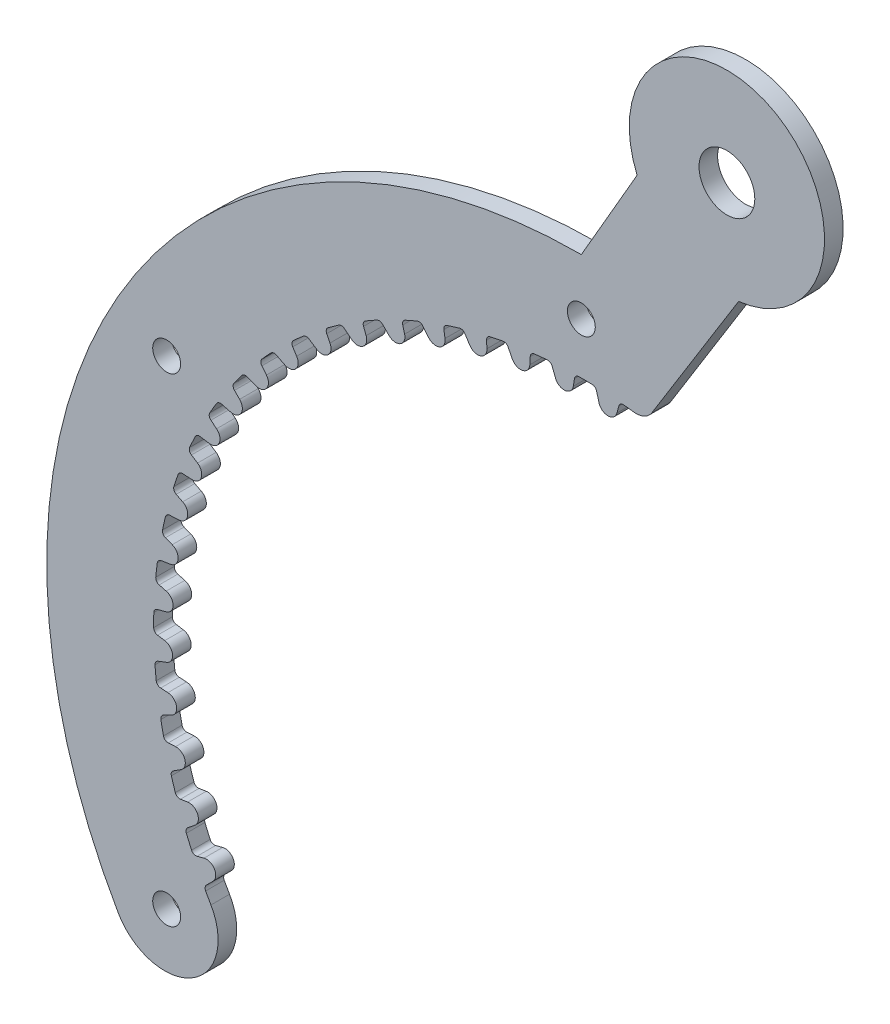
from build123d import *

# Parameters (mm, degrees)
SKETCH_1_R          = 3
EXTRUDE_1_DEPTH     = 2
FILLET_1_R          = 2
SKETCH_2_R          = 1.5
CUT_EXTRUDE_1_DEPTH = 10


with BuildPart() as part:
    # 草图1 → 凸台-拉伸1 (new body)
    with BuildSketch(Plane.XY):
        with BuildLine():
            Line((0, 57.5), (6, 67.892304845))
            ThreePointArc((6, 67.892304845), (20.905960044, 81.110184977), (16.911920088, 61.592304845))
            Line((16.911920088, 61.592304845), (6.915077614, 45.477265766))
            ThreePointArc((6.915077614, 45.477265766), (5.741141936, 45.640325254), (4.563394983, 45.773086265))
            ThreePointArc((4.563394983, 45.773086265), (4.229488065, 45.686856477), (4.030829951, 45.404962241))
            Line((4.030829951, 45.404962241), (3.828548462, 44.650037449))
            ThreePointArc((3.828548462, 44.650037449), (2.862622636, 43.908856495), (1.89669681, 44.650037449))
            Line((1.89669681, 44.650037449), (1.638205167, 45.614741393))
            ThreePointArc((1.638205167, 45.614741393), (1.46463464, 45.878112154), (1.167937224, 45.985170682))
            ThreePointArc((1.167937224, 45.985170682), (0.460926002, 45.997690673), (-0.246194138, 45.999341174))
            ThreePointArc((-0.246194138, 45.999341174), (-0.569258412, 45.878680985), (-0.737362285, 45.577565568))
            Line((-0.737362285, 45.577565568), (-0.859624526, 44.80563216))
            ThreePointArc((-0.859624526, 44.80563216), (-1.742784404, 43.967544729), (-2.780893293, 44.603698675))
            Line((-2.780893293, 44.603698675), (-3.138807912, 45.536098135))
            ThreePointArc((-3.138807912, 45.536098135), (-3.338957342, 45.779883063), (-3.645220083, 45.855341789))
            ThreePointArc((-3.645220083, 45.855341789), (-4.349666918, 45.793890397), (-5.053085905, 45.721617675))
            ThreePointArc((-5.053085905, 45.721617675), (-5.361767975, 45.567849063), (-5.497475826, 45.250811548))
            Line((-5.497475826, 45.250811548), (-5.538379289, 44.470326988))
            ThreePointArc((-5.538379289, 44.470326988), (-6.329097132, 43.544515343), (-7.428015347, 44.068672444))
            Line((-7.428015347, 44.068672444), (-7.881431555, 44.958551858))
            ThreePointArc((-7.881431555, 44.958551858), (-8.10596701, 45.180079994), (-8.418439596, 45.223112175))
            ThreePointArc((-8.418439596, 45.223112175), (-9.112603978, 45.088362675), (-9.804615006, 44.942958565))
            ThreePointArc((-9.804615006, 44.942958565), (-10.095532886, 44.757766251), (-10.197357871, 44.428280168))
            Line((-10.197357871, 44.428280168), (-10.156454408, 43.647795608))
            ThreePointArc((-10.156454408, 43.647795608), (-10.846066949, 42.644403135), (-11.993754511, 43.050820616))
            Line((-11.993754511, 43.050820616), (-12.537704585, 43.888430278))
            ThreePointArc((-12.537704585, 43.888430278), (-12.784166007, 44.085274514), (-13.099424923, 44.09540868))
            ThreePointArc((-13.099424923, 44.09540868), (-13.775701442, 43.888837417), (-14.448722692, 43.671894996))
            ThreePointArc((-14.448722692, 43.671894996), (-14.718689026, 43.457307986), (-14.785515529, 43.118983253))
            Line((-14.785515529, 43.118983253), (-14.663253288, 42.347049845))
            ThreePointArc((-14.663253288, 42.347049845), (-15.244204986, 41.277069922), (-16.42808759, 41.561294989))
            Line((-16.42808759, 41.561294989), (-17.0566119, 42.337457871))
            ThreePointArc((-17.0566119, 42.337457871), (-17.322299005, 42.50746154), (-17.636890209, 42.484586661))
            ThreePointArc((-17.636890209, 42.484586661), (-18.287869438, 42.208456871), (-18.93452715, 41.922353007))
            ThreePointArc((-18.93452715, 41.922353007), (-19.180584129, 41.68072236), (-19.211679985, 41.337265734))
            Line((-19.211679985, 41.337265734), (-19.009398497, 40.582340942))
            ThreePointArc((-19.009398497, 40.582340942), (-19.475324323, 39.457496493), (-20.682431104, 39.616415116))
            Line((-20.682431104, 39.616415116), (-21.388643405, 40.322627417))
            ThreePointArc((-21.388643405, 40.322627417), (-21.670645271, 40.463927923), (-21.981122035, 40.40829462))
            ThreePointArc((-21.981122035, 40.40829462), (-22.599671709, 40.065631639), (-23.212880965, 39.713500945))
            ThreePointArc((-23.212880965, 39.713500945), (-23.432332739, 39.447474019), (-23.427357255, 39.102648482))
            Line((-23.427357255, 39.102648482), (-23.147272757, 38.37300342))
            ThreePointArc((-23.147272757, 38.37300342), (-23.493067932, 37.205618476), (-24.710173575, 37.237489509))
            Line((-24.710173575, 37.237489509), (-25.486336457, 37.866013818))
            ThreePointArc((-25.486336457, 37.866013818), (-25.781563412, 37.977063044), (-26.084524089, 37.889280847))
            ThreePointArc((-26.084524089, 37.889280847), (-26.663867248, 37.483838963), (-27.236909599, 37.069539456))
            ThreePointArc((-27.236909599, 37.069539456), (-27.427351807, 36.782030896), (-27.386359496, 36.43961443))
            Line((-27.386359496, 36.43961443), (-27.031540654, 35.743243242))
            ThreePointArc((-27.031540654, 35.743243242), (-27.253416571, 34.546107917), (-28.467186213, 34.450582174))
            Line((-28.467186213, 34.450582174), (-29.304795874, 34.994532248))
            ThreePointArc((-29.304795874, 34.994532248), (-29.61001335, 35.074113515), (-29.902138638, 34.955144184))
            ThreePointArc((-29.902138638, 34.955144184), (-30.435927877, 34.491365503), (-30.962524952, 34.019436336))
            ThreePointArc((-30.962524952, 34.019436336), (-31.12187107, 33.713596147), (-31.045311052, 33.377340336))
            Line((-31.045311052, 33.377340336), (-30.619645334, 32.721872611))
            ThreePointArc((-30.619645334, 32.721872611), (-30.715171076, 31.50810297), (-31.912306402, 31.286227052))
            Line((-31.912306402, 31.286227052), (-32.802185815, 31.73964326))
            ThreePointArc((-32.802185815, 31.73964326), (-33.114049785, 31.786884658), (-33.392139098, 31.638031646))
            ThreePointArc((-33.392139098, 31.638031646), (-33.874526112, 31.120997424), (-34.348908402, 30.596609152))
            ThreePointArc((-34.348908402, 30.596609152), (-34.4754126, 30.275788183), (-34.364123683, 29.949377118))
            Line((-34.364123683, 29.949377118), (-33.872274772, 29.341994297))
            ThreePointArc((-33.872274772, 29.341994297), (-33.840403739, 28.124888653), (-35.007788683, 27.779093479))
            Line((-35.007788683, 27.779093479), (-35.940188143, 28.137008098))
            ThreePointArc((-35.940188143, 28.137008098), (-36.255281761, 28.151392042), (-36.516288295, 27.974286213))
            ThreePointArc((-36.516288295, 27.974286213), (-36.94198795, 27.409661186), (-37.358958024, 26.838559115))
            ThreePointArc((-37.358958024, 26.838559115), (-37.451234295, 26.506272348), (-37.306435784, 26.193282256))
            Line((-37.306435784, 26.193282256), (-36.75379248, 25.640638953))
            ThreePointArc((-36.75379248, 25.640638953), (-36.594873857, 24.433532171), (-37.719718306, 23.967606345))
            Line((-37.719718306, 23.967606345), (-38.68442225, 24.226097988))
            ThreePointArc((-38.68442225, 24.226097988), (-38.999293283, 24.207466883), (-39.240357396, 24.004048647))
            ThreePointArc((-39.240357396, 24.004048647), (-39.604705637, 23.398018964), (-39.959695083, 22.786460209))
            ThreePointArc((-39.959695083, 22.786460209), (-40.016732431, 22.446348246), (-39.840010767, 22.150208313))
            Line((-39.840010767, 22.150208313), (-39.232627946, 21.658359402))
            ThreePointArc((-39.232627946, 21.658359402), (-38.948402879, 20.474476798), (-40.018382802, 19.8935251))
            Line((-40.018382802, 19.8935251), (-41.00482173, 20.049761678))
            ThreePointArc((-41.00482173, 20.049761678), (-41.316020386, 19.998319651), (-41.53450093, 19.7708177))
            ThreePointArc((-41.53450093, 19.7708177), (-41.833505881, 19.130023149), (-42.122625362, 18.484708076))
            ThreePointArc((-42.122625362, 18.484708076), (-42.143798872, 18.140497256), (-41.937090256, 17.864452052))
            Line((-41.937090256, 17.864452052), (-41.28162253, 17.438786334))
            ThreePointArc((-41.28162253, 17.438786334), (-40.875205049, 16.291098772), (-41.878597522, 15.601486232))
            Line((-41.878597522, 15.601486232), (-42.875963804, 15.653755984))
            ThreePointArc((-42.875963804, 15.653755984), (-43.180080525, 15.570066644), (-43.373583779, 15.320973537))
            ThreePointArc((-43.373583779, 15.320973537), (-43.603969481, 14.652434798), (-43.824051342, 13.980433613))
            ThreePointArc((-43.824051342, 13.980433613), (-43.809129033, 13.635895181), (-43.574698207, 13.382969116))
            Line((-43.574698207, 13.382969116), (-42.87832702, 13.028150274))
            ThreePointArc((-42.87832702, 13.028150274), (-42.354169919, 11.929232059), (-43.279981563, 11.138514215))
            Line((-43.279981563, 11.138514215), (-44.277347845, 11.086244463))
            ThreePointArc((-44.277347845, 11.086244463), (-44.571050665, 10.971224729), (-44.737456569, 10.703269582))
            ThreePointArc((-44.737456569, 10.703269582), (-44.896698866, 10.014311305), (-45.045331844, 9.322986594))
            ThreePointArc((-45.045331844, 9.322986594), (-44.994477209, 8.981895386), (-44.734892647, 8.75485957))
            Line((-44.734892647, 8.75485957), (-44.005247585, 8.474775073))
            ThreePointArc((-44.005247585, 8.474775073), (-43.369093639, 7.436666183), (-44.20718107, 6.553506306))
            Line((-44.20718107, 6.553506306), (-45.193619998, 6.397269728))
            ThreePointArc((-45.193619998, 6.397269728), (-45.473691047, 6.25217978), (-45.611176422, 5.968298366))
            ThreePointArc((-45.611176422, 5.968298366), (-45.697530624, 5.266468921), (-45.773086265, 4.563394983))
            ThreePointArc((-45.773086265, 4.563394983), (-45.686856477, 4.229488065), (-45.404962241, 4.030829951))
            Line((-45.404962241, 4.030829951), (-44.650037449, 3.828548462))
            ThreePointArc((-44.650037449, 3.828548462), (-43.908856495, 2.862622636), (-44.650037449, 1.89669681))
            Line((-44.650037449, 1.89669681), (-45.614741393, 1.638205167))
            ThreePointArc((-45.614741393, 1.638205167), (-45.878112154, 1.46463464), (-45.985170682, 1.167937224))
            ThreePointArc((-45.985170682, 1.167937224), (-45.997690673, 0.460926002), (-45.999341174, -0.246194138))
            ThreePointArc((-45.999341174, -0.246194138), (-45.878680984, -0.569258412), (-45.577565568, -0.737362285))
            Line((-45.577565568, -0.737362285), (-44.80563216, -0.859624526))
            ThreePointArc((-44.80563216, -0.859624526), (-43.967544729, -1.742784404), (-44.603698675, -2.780893293))
            Line((-44.603698675, -2.780893293), (-45.536098135, -3.138807912))
            ThreePointArc((-45.536098135, -3.138807912), (-45.779883063, -3.338957342), (-45.855341789, -3.645220083))
            ThreePointArc((-45.855341789, -3.645220083), (-45.793890397, -4.349666918), (-45.721617675, -5.053085905))
            ThreePointArc((-45.721617675, -5.053085905), (-45.567849063, -5.361767975), (-45.250811548, -5.497475826))
            Line((-45.250811548, -5.497475826), (-44.470326988, -5.538379289))
            ThreePointArc((-44.470326988, -5.538379289), (-43.544515343, -6.329097132), (-44.068672444, -7.428015347))
            Line((-44.068672444, -7.428015347), (-44.958551858, -7.881431555))
            ThreePointArc((-44.958551858, -7.881431555), (-45.180079994, -8.10596701), (-45.223112175, -8.418439596))
            ThreePointArc((-45.223112175, -8.418439596), (-45.088362675, -9.112603978), (-44.942958565, -9.804615006))
            ThreePointArc((-44.942958565, -9.804615006), (-44.757766251, -10.095532886), (-44.428280168, -10.197357871))
            Line((-44.428280168, -10.197357871), (-43.647795608, -10.156454408))
            ThreePointArc((-43.647795608, -10.156454408), (-42.644403135, -10.846066949), (-43.050820616, -11.993754511))
            Line((-43.050820616, -11.993754511), (-43.888430278, -12.537704585))
            ThreePointArc((-43.888430278, -12.537704585), (-44.085274514, -12.784166007), (-44.09540868, -13.099424923))
            ThreePointArc((-44.09540868, -13.099424923), (-43.888837417, -13.775701442), (-43.671894996, -14.448722692))
            ThreePointArc((-43.671894996, -14.448722692), (-43.457307986, -14.718689026), (-43.118983253, -14.785515529))
            Line((-43.118983253, -14.785515529), (-42.347049845, -14.663253288))
            ThreePointArc((-42.347049845, -14.663253288), (-41.277069922, -15.244204986), (-41.561294989, -16.42808759))
            Line((-41.561294989, -16.42808759), (-42.337457871, -17.0566119))
            ThreePointArc((-42.337457871, -17.0566119), (-42.50746154, -17.322299005), (-42.484586661, -17.636890209))
            ThreePointArc((-42.484586661, -17.636890209), (-42.208456871, -18.287869438), (-41.922353007, -18.93452715))
            ThreePointArc((-41.922353007, -18.93452715), (-41.68072236, -19.180584129), (-41.337265734, -19.211679985))
            Line((-41.337265734, -19.211679985), (-40.582340942, -19.009398497))
            ThreePointArc((-40.582340942, -19.009398497), (-39.457496493, -19.475324323), (-39.616415116, -20.682431104))
            Line((-39.616415116, -20.682431104), (-40.322627417, -21.388643405))
            ThreePointArc((-40.322627417, -21.388643405), (-40.463927923, -21.670645271), (-40.40829462, -21.981122035))
            ThreePointArc((-40.40829462, -21.981122035), (-40.125965644, -22.492373844), (-39.837168574, -23))
            ThreePointArc((-39.837168574, -23), (-41.941814646, -30.854646072), (-49.796460718, -28.75))
            ThreePointArc((-49.796460718, -28.75), (-49.796460718, 28.75), (0, 57.5))
        make_face()
        with Locations((15.655960044, 72.016918237)):
            Circle(SKETCH_1_R, mode=Mode.SUBTRACT)
    extrude(amount=EXTRUDE_1_DEPTH)

    # 圆角1
    fillet_1_edges = [part.edges().sort_by_distance(p)[0] for p in [
        (6.915077614, 45.477265766, 1),
    ]]
    fillet(fillet_1_edges, radius=FILLET_1_R)

    # 草图2 → 切除-拉伸1 (cut)
    with BuildSketch(Plane.XY.offset(2)):
        with Locations((0, 51.5)):
            Circle(SKETCH_2_R)
        with Locations((-44.600308295, -25.75)):
            Circle(SKETCH_2_R)
        with Locations((-44.600308295, 25.75)):
            Circle(SKETCH_2_R)
    extrude(amount=-CUT_EXTRUDE_1_DEPTH, mode=Mode.SUBTRACT)


solid = part.part
